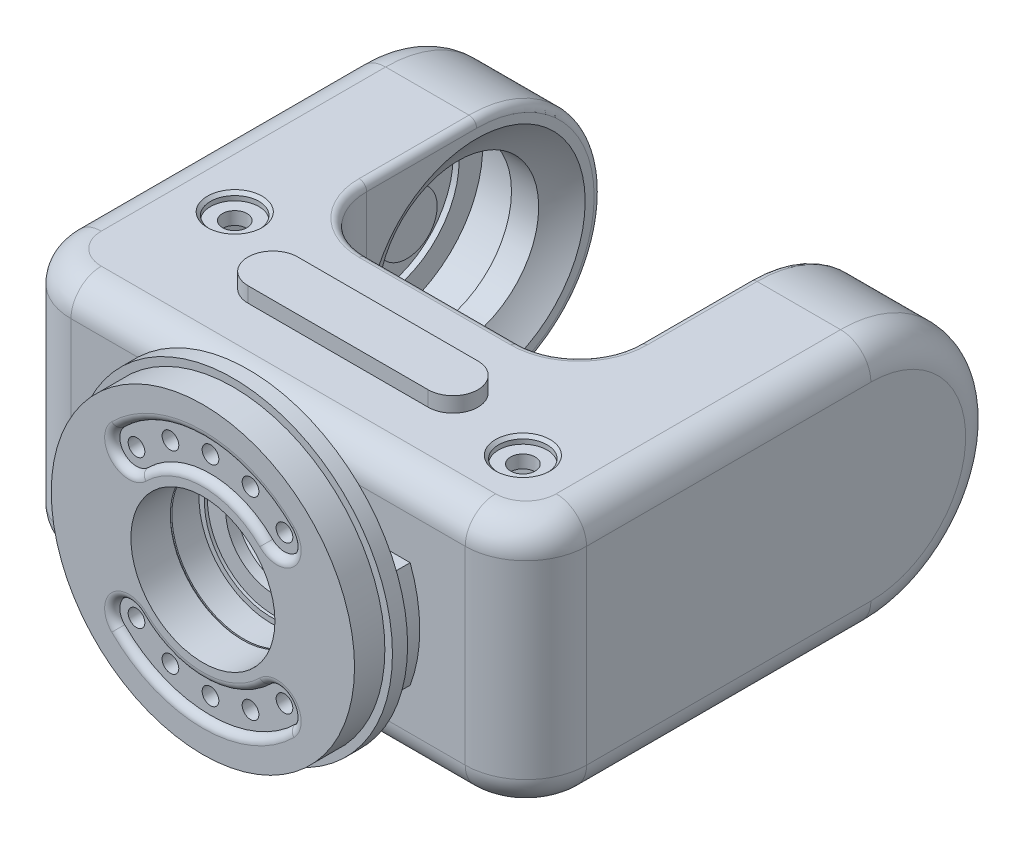
from build123d import *
from build123d.topology import SkipClean

# Parameters (mm, degrees)
SKETCH1_R                  = 100
EXTRUDE1_DEPTH             = 15
F_11_0_11_DIAMETER_HOLE3_D = 11
EXTRUDE2_DEPTH             = 5
FILLET1_R                  = 5
SKETCH12_R                 = 58
EXTRUDE6_DEPTH             = 23
EXTRUDE7_REACH             = 153.026
EXTRUDE12_DEPTH            = 82.5
FILLET2_RADIUS             = 82.5
FILLET2_LENGTH             = 80
FILLET3_RADIUS             = 82.5
FILLET3_LENGTH             = 80
EXTRUDE13_DEPTH            = 69
FILLET4_R                  = 20
SKETCH24_R                 = 53
EXTRUDE14_DEPTH            = 155
SKETCH27_R                 = 69
EXTRUDE16_DEPTH            = 35
EXTRUDE17_START            = 35
SKETCH28_R                 = 69
EXTRUDE17_DEPTH            = 35
SKETCH30_R                 = 53.5
EXTRUDE18_DEPTH            = 4
FILLET5_R                  = 8
SKETCH34_R                 = 26
EXTRUDE19_DEPTH            = 138
SKETCH35_R                 = 16
EXTRUDE21_DEPTH            = 5
CHAMFER2_SIZE              = 2
EXTRUDE22_DEPTH            = 392.336173
EXTRUDE22_DEPTH_BACK       = 392.336173
SKETCH36_R                 = 8.1
FILLET6_R                  = 5
SKETCH37_R                 = 105
SKETCH37_R_2               = 100
EXTRUDE23_DEPTH            = 10
BOSS_EXTRUDE1_DEPTH        = 10


with BuildPart() as part:
    # Sketch1 → Extrude1 (new, symmetric)
    with BuildSketch(Plane.XY):
        Circle(SKETCH1_R)
    extrude(amount=EXTRUDE1_DEPTH, both=True)

    # Ø11.0 (11) Diameter Hole3 (through all)
    with Locations(Plane(origin=(0, 0, -15), x_dir=(-1, 0, 0), z_dir=(0, 0, -1))):
        with Locations((-48.790368, 48.790368), (-26.405157, 63.747688), (0, 69), (26.405157, 63.747688), (48.790368, 48.790368), (48.790368, -48.790368), (26.405157, -63.747688), (0, -69), (-26.405157, -63.747688), (-48.790368, -48.790368)):
            Hole(F_11_0_11_DIAMETER_HOLE3_D / 2)

    # Sketch2 → Extrude2 (cut)
    with BuildSketch(Plane.XY.offset(15)):
        with BuildLine():
            ThreePointArc((56.568542, 56.568542), (0, 80), (-56.568542, 56.568542))
            ThreePointArc((-56.568542, 56.568542), (-56.568542, 41.012193), (-41.012193, 41.012193))
            ThreePointArc((-41.012193, 41.012193), (0, 58), (41.012193, 41.012193))
            ThreePointArc((41.012193, 41.012193), (56.568542, 41.012193), (56.568542, 56.568542))
        make_face()
        with BuildLine():
            ThreePointArc((56.568542, -56.568542), (0, -80), (-56.568542, -56.568542))
            ThreePointArc((-56.568542, -56.568542), (-56.568542, -41.012193), (-41.012193, -41.012193))
            ThreePointArc((-41.012193, -41.012193), (0, -58), (41.012193, -41.012193))
            ThreePointArc((41.012193, -41.012193), (56.568542, -41.012193), (56.568542, -56.568542))
        make_face()
    extrude(amount=-EXTRUDE2_DEPTH, mode=Mode.SUBTRACT)

    # Fillet1
    fillet1_edges = [part.edges().sort_by_distance(p)[0] for p in [
        (-56.568542, -41.012193, 15),
        (0, -80, 15),
        (56.568542, -41.012193, 15),
        (0, -58, 15),
        (0, 80, 15),
        (-56.568542, 41.012193, 15),
        (56.568542, 41.012193, 15),
        (0, 58, 15),
    ]]
    fillet(fillet1_edges, radius=FILLET1_R - 0.0001)  # a hair under: the kernel refuses the full size

    # Sketch12 → Extrude6 (add)
    with BuildSketch(Plane(origin=(0, 0, -15), x_dir=(-1, 0, 0), z_dir=(0, 0, -1))):
        with Locations(Location((0, 0, 0), (0, 0, 180))):
            Circle(SKETCH12_R)
    extrude(amount=EXTRUDE6_DEPTH)

    # Sketch15 → Cut-Revolve1 (revolve, cut)
    with BuildSketch(Plane(origin=(0, 0, 0), x_dir=(1, 0, 0), z_dir=(0, 1, 0))):
        Polygon((0, 38), (32, 38), (32, 32), (44, 32), (44, 30), (47.5, 30), (47.5, 12), (48.5, 12), (48.5, 11), (47.5, 11), (47.5, -15), (0, -15), align=None)
    revolve(axis=Axis((0, 0, 15), (0, 0, -1)), mode=Mode.SUBTRACT)

    # Sketch16 → Extrude7 (add, up to next)
    with BuildSketch(Plane(origin=(0, 0, -38), x_dir=(-1, 0, 0), z_dir=(0, 0, -1)), mode=Mode.PRIVATE) as extrude7_sk1:
        with BuildLine():
            Line((-93.67497, 35), (-46.249324, 35))
            ThreePointArc((-46.249324, 35), (-58, 0), (-46.249324, -35))
            Line((-46.249324, -35), (-93.67497, -35))
            ThreePointArc((-93.67497, -35), (-100, 0), (-93.67497, 35))
        make_face()
    extrude7_tool1 = extrude(extrude7_sk1.sketch, amount=-EXTRUDE7_REACH, mode=Mode.PRIVATE) - part.part
    # Sketch16 → Extrude7 (add, up to next)
    with BuildSketch(Plane(origin=(0, 0, -38), x_dir=(-1, 0, 0), z_dir=(0, 0, -1)), mode=Mode.PRIVATE) as extrude7_sk2:
        with BuildLine():
            Line((46.249324, 35), (93.67497, 35))
            ThreePointArc((93.67497, 35), (100, 0), (93.67497, -35))
            Line((93.67497, -35), (46.249324, -35))
            ThreePointArc((46.249324, -35), (58, 0), (46.249324, 35))
        make_face()
    extrude7_tool2 = extrude(extrude7_sk2.sketch, amount=-EXTRUDE7_REACH, mode=Mode.PRIVATE) - part.part
    add(extrude7_tool1.solids().sort_by_distance((75.992672, 0, -38))[0])
    add(extrude7_tool2.solids().sort_by_distance((-75.992672, 0, -38))[0])

    # Sketch20 → Extrude12 (add, symmetric)
    with BuildSketch(Plane(origin=(0, 0, 0), x_dir=(1, 0, 0), z_dir=(0, 1, 0))):
        with BuildLine():
            Line((-50, 143), (50, 143))
            ThreePointArc((50, 143), (78.284271, 154.715729), (90, 183))
            Line((90, 183), (90, 338))
            Line((90, 338), (170, 338))
            Line((170, 338), (170, 68))
            ThreePointArc((170, 68), (158.284271, 39.715729), (130, 28))
            Line((130, 28), (-130, 28))
            ThreePointArc((-130, 28), (-158.284271, 39.715729), (-170, 68))
            Line((-170, 68), (-170, 338))
            Line((-170, 338), (-90, 338))
            Line((-90, 338), (-90, 183))
            ThreePointArc((-90, 183), (-78.284271, 154.715729), (-50, 143))
        make_face()
    extrude(amount=EXTRUDE12_DEPTH, both=True)

    # Fillet2: full round fillet: the end face becomes a half cylinder, R = half its width
    fillet2_face = Plane((130, 0, -338), x_dir=(-1, 0, 0), z_dir=(0, 0, -1))  # on the end face: x along it, z out of the body
    fillet2_slab = fillet2_face.offset(-FILLET2_RADIUS / 2) * Box(FILLET2_LENGTH, 2 * FILLET2_RADIUS, FILLET2_RADIUS, mode=Mode.PRIVATE)  # the body's end, R deep
    fillet2_round = Plane((130, 0, -255.5), x_dir=(0, 0, -1), z_dir=(-1, 0, 0)) * Cylinder(FILLET2_RADIUS, FILLET2_LENGTH, mode=Mode.PRIVATE)  # its axis R under the face
    add(fillet2_slab - fillet2_round, mode=Mode.SUBTRACT)

    # Fillet3: full round fillet: the end face becomes a half cylinder, R = half its width
    fillet3_face = Plane((-130, 0, -338), x_dir=(-1, 0, 0), z_dir=(0, 0, -1))  # on the end face: x along it, z out of the body
    fillet3_slab = fillet3_face.offset(-FILLET3_RADIUS / 2) * Box(FILLET3_LENGTH, 2 * FILLET3_RADIUS, FILLET3_RADIUS, mode=Mode.PRIVATE)  # the body's end, R deep
    fillet3_round = Plane((-130, 0, -255.5), x_dir=(0, 0, -1), z_dir=(-1, 0, 0)) * Cylinder(FILLET3_RADIUS, FILLET3_LENGTH, mode=Mode.PRIVATE)  # its axis R under the face
    add(fillet3_slab - fillet3_round, mode=Mode.SUBTRACT)

    # Sketch21 → Cut-Revolve2 (revolve, cut)
    with BuildSketch(Plane(origin=(0, 0, 0), x_dir=(1, 0, 0), z_dir=(0, 1, 0)), mode=Mode.PRIVATE) as cut_revolve2_sk:
        with BuildLine():
            Line((0, 370.5), (0, 153))
            Line((0, 153), (52.141634, 153))
            ThreePointArc((52.141634, 153), (111.831346, 282.309513), (0, 370.5))
        make_face()
    revolve(cut_revolve2_sk.sketch.rotate(Axis((0, 0, -370.5), (0, 0, 1)), 159.512685), axis=Axis((0, 0, -370.5), (0, 0, 1)), mode=Mode.SUBTRACT)

    # Sketch23 → Extrude13 (cut, symmetric)
    with BuildSketch(Plane(origin=(0, 0, 0), x_dir=(1, 0, 0), z_dir=(0, 1, 0))):
        with BuildLine():
            Line((-155, 255.5), (-120, 255.5))
            Line((-120, 255.5), (-120, 168))
            ThreePointArc((-120, 168), (-108.284271, 139.715729), (-80, 128))
            Line((-80, 128), (80, 128))
            ThreePointArc((80, 128), (108.284271, 139.715729), (120, 168))
            Line((120, 168), (120, 255.5))
            Line((120, 255.5), (155, 255.5))
            Line((155, 255.5), (155, 86))
            ThreePointArc((155, 86), (143.284271, 57.715729), (115, 46))
            Line((115, 46), (-115, 46))
            ThreePointArc((-115, 46), (-143.284271, 57.715729), (-155, 86))
            Line((-155, 86), (-155, 255.5))
        make_face()
    extrude(amount=EXTRUDE13_DEPTH, both=True, mode=Mode.SUBTRACT)

    # Fillet4
    fillet4_edges = [part.edges().sort_by_distance(p)[0] for p in [
        (-158.284271, -82.5, -39.715729),
        (0, -82.5, -28),
        (158.284271, -82.5, -39.715729),
        (170, -82.5, -161.75),
        (-158.284271, 82.5, -39.715729),
        (0, 82.5, -28),
        (158.284271, 82.5, -39.715729),
        (170, 82.5, -161.75),
        (170, -58.336309, -313.836309),
        (-170, -82.5, -161.75),
        (-170, 82.5, -161.75),
        (-170, -58.336309, -313.836309),
    ]]
    fillet(fillet4_edges, radius=FILLET4_R)

    # Sketch24 → Extrude14 (cut, symmetric)
    with SkipClean():  # the faces are left unmerged after this step: merging them gives an invalid solid
        with BuildSketch(Plane(origin=(0, 0, 0), x_dir=(0, 0, -1), z_dir=(1, 0, 0))):
            with Locations(Location((255.5, 0, 0), (0, 0, 90))):
                Circle(SKETCH24_R)
        extrude(amount=EXTRUDE14_DEPTH, both=True, mode=Mode.SUBTRACT)

    # Sketch27 → Extrude16 (cut)
    with SkipClean():  # the faces are left unmerged after this step: merging them gives an invalid solid
        with BuildSketch(Plane(origin=(-155, 0, 0), x_dir=(0, 0, -1), z_dir=(1, 0, 0))):
            with Locations((255.5, 0)):
                Circle(SKETCH27_R)
        extrude(amount=EXTRUDE16_DEPTH, mode=Mode.SUBTRACT)

    # Sketch28 → Extrude17 (cut)
    with SkipClean():  # the faces are left unmerged after this step: merging them gives an invalid solid
        with BuildSketch(Plane.ZY.offset(-155).offset(EXTRUDE17_START)):
            with Locations((-255.5, 0)):
                Circle(SKETCH28_R)
        extrude(amount=-EXTRUDE17_DEPTH, mode=Mode.SUBTRACT)

    # Sketch29 → Cut-Revolve3 (revolve, cut)
    with SkipClean():  # the faces are left unmerged after this step: merging them gives an invalid solid
        with BuildSketch(Plane(origin=(0, 0, 0), x_dir=(1, 0, 0), z_dir=(0, 1, 0))):
            Polygon((0, 28), (47.5, 28), (47.5, 30), (44, 30), (44, 32), (32, 32), (32, 39), (53.5, 39), (53.5, 127), (34.5, 127), (34.5, 143), (0, 143), align=None)
        revolve(axis=Axis((0, 0, 15), (0, 0, -1)), mode=Mode.SUBTRACT)

    # Sketch30 → Extrude18 (cut)
    with SkipClean():  # the faces are left unmerged after this step: merging them gives an invalid solid
        with BuildSketch(Plane(origin=(-155, 0, 0), x_dir=(0, 0, -1), z_dir=(1, 0, 0))):
            with Locations((255.5, 0)):
                Circle(SKETCH30_R)
        extrude18 = extrude(amount=-EXTRUDE18_DEPTH, mode=Mode.SUBTRACT)

    # Mirror1: Extrude18 across plane
    with SkipClean():  # the faces are left unmerged after this step: merging them gives an invalid solid
        add(extrude18.mirror(Plane(origin=(0, 0, 0), x_dir=(0, 0, 1), z_dir=(1, 0, 0))), mode=Mode.SUBTRACT)

    # Sketch33 → Revolve1 (revolve)
    with SkipClean():  # the faces are left unmerged after this step: merging them gives an invalid solid
        with BuildSketch(Plane(origin=(0, 0, 0), x_dir=(1, 0, 0), z_dir=(0, 1, 0)), mode=Mode.PRIVATE) as revolve1_sk:
            Polygon((159, 255.5), (159, 278), (151, 278), (151, 275.5), (136, 275.5), (136, 255.5), align=None)
        revolve1 = revolve(revolve1_sk.sketch.rotate(Axis((170, 0, -255.5), (1, 0, 0)), 180), axis=Axis((170, 0, -255.5), (1, 0, 0)))

    # Mirror2: Revolve1 across plane
    with SkipClean():  # the faces are left unmerged after this step: merging them gives an invalid solid
        add(revolve1.mirror(Plane(origin=(0, 0, 0), x_dir=(0, 0, 1), z_dir=(1, 0, 0))))

    # Fillet5
    fillet5_edges = [part.edges().sort_by_distance(p)[0] for p in [
        (159, 0, -278),
        (-159, 0, -278),
    ]]
    fillet(fillet5_edges, radius=FILLET5_R - 0.0001)  # a hair under: the kernel refuses the full size

    # Sketch34 → Extrude19 (cut)
    with SkipClean():  # the faces are left unmerged after this step: merging them gives an invalid solid
        with BuildSketch(Plane.XZ.offset(-69)):
            with Locations((-117, -123)):
                Circle(SKETCH34_R)
        extrude(amount=EXTRUDE19_DEPTH, mode=Mode.SUBTRACT)

    # Sketch35 → Extrude21 (cut)
    with SkipClean():  # the faces are left unmerged after this step: merging them gives an invalid solid
        with BuildSketch(Plane.XZ.offset(82.5)):
            with Locations(Location((-117, -123, 0), (0, 0, 270))):
                Circle(SKETCH35_R)
            with Locations(Location((117, -79, 0), (0, 0, 270))):
                Circle(SKETCH35_R)
        extrude21 = extrude(amount=-EXTRUDE21_DEPTH, mode=Mode.SUBTRACT)

    # Mirror5: Extrude21 across plane
    with SkipClean():  # the faces are left unmerged after this step: merging them gives an invalid solid
        add(extrude21.mirror(Plane.ZX), mode=Mode.SUBTRACT)

    # Chamfer2
    chamfer2_edges = [part.edges().sort_by_distance(p)[0] for p in [
        (-117, -82.5, -107),
        (117, -82.5, -63),
        (-117, 82.5, -107),
        (117, 82.5, -63),
    ]]
    chamfer(chamfer2_edges, length=CHAMFER2_SIZE)

    # Sketch36 → Extrude22 (cut, two sides: drawn at the far end of the back side and taken through both)
    with SkipClean():  # the faces are left unmerged after this step: merging them gives an invalid solid
        with BuildSketch(Plane(origin=(0, 0, 0), x_dir=(1, 0, 0), z_dir=(0, 1, 0)).offset(-EXTRUDE22_DEPTH_BACK)):
            with Locations(Location((-117, 123, 0), (0, 0, 270))):
                Circle(SKETCH36_R)
            with Locations(Location((117, 79, 0), (0, 0, 270))):
                Circle(SKETCH36_R)
        extrude(amount=EXTRUDE22_DEPTH + EXTRUDE22_DEPTH_BACK, mode=Mode.SUBTRACT)

    # Fillet6
    fillet6_edges = [part.edges().sort_by_distance(p)[0] for p in [
        (78.284271, -82.5, -154.715729),
        (0, -82.5, -143),
        (-78.284271, -82.5, -154.715729),
        (-90, -82.5, -219.25),
        (78.284271, 82.5, -154.715729),
        (0, 82.5, -143),
        (-78.284271, 82.5, -154.715729),
        (-90, 82.5, -219.25),
        (90, 82.5, -219.25),
        (90, -82.5, -219.25),
        (90, -58.336309, -313.836309),
        (-90, -58.336309, -313.836309),
    ]]
    fillet(fillet6_edges, radius=FILLET6_R)

    # Sketch37 → Extrude23 (add)
    with SkipClean():  # the faces are left unmerged after this step: merging them gives an invalid solid
        with BuildSketch(Plane(origin=(0, 0, -15), x_dir=(-1, 0, 0), z_dir=(0, 0, -1))):
            Circle(SKETCH37_R)
            Circle(SKETCH37_R_2, mode=Mode.SUBTRACT)
        extrude(amount=-EXTRUDE23_DEPTH)

    # Sketch39 → Boss-Extrude1 (add)
    with SkipClean():  # the faces are left unmerged after this step: merging them gives an invalid solid
        with BuildSketch(Plane(origin=(0, 82.5, 0), x_dir=(1, 0, 0), z_dir=(0, 1, 0))):
            with BuildLine():
                Line((-60.472418, 108.016857), (58.345247, 108.016857))
                ThreePointArc((58.345247, 108.016857), (74.754848, 91.607256), (58.345247, 75.197655))
                Line((58.345247, 75.197655), (-60.472418, 75.197655))
                ThreePointArc((-60.472418, 75.197655), (-76.882019, 91.607256), (-60.472418, 108.016857))
            make_face()
        extrude(amount=BOSS_EXTRUDE1_DEPTH)


solid = part.part
